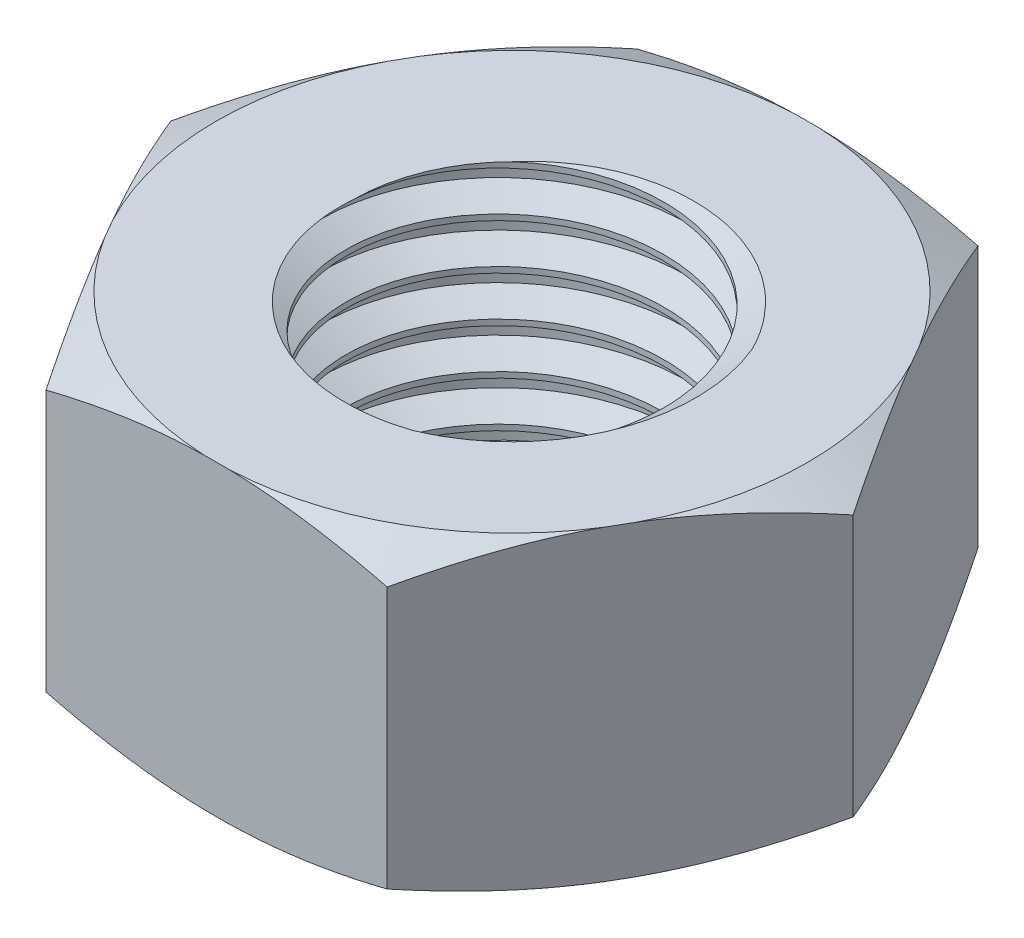
from build123d import *

# Parameters (mm, degrees)
CUT_EXTRUDE1_DEPTH      = 13.572290961
CUT_EXTRUDE1_DEPTH_BACK = 13.572290961
SKETCH2_OUTSIDE_W       = 21.452
SKETCH2_OUTSIDE_H       = 21.452
THREAD1_PITCH           = 1


with BuildPart() as part:
    # Sketch1 → Revolve1 (revolve)
    with BuildSketch(Plane(origin=(0, 0, 0), x_dir=(0, 0, -1), z_dir=(1, 0, 0)), mode=Mode.PRIVATE) as revolve1_sk:
        Polygon((-3.5, 0), (-3.5, 6.75), (-6.5, 6.75), (-7.5, 6.25), (-7.5, 0.5), (-6.5, 0), align=None)
    revolve(revolve1_sk.sketch.rotate(Axis((0, 0, 0), (0, 1, 0)), 180), axis=Axis((0, 0, 0), (0, 1, 0)))

    # Sketch2 outside → Cut-Extrude1 (cut, two sides: drawn at the far end of the back side and taken through both)
    with BuildSketch(Plane(origin=(0, 6.75, 0), x_dir=(1, 0, 0), z_dir=(0, 1, 0)).offset(-CUT_EXTRUDE1_DEPTH_BACK)):
        Rectangle(SKETCH2_OUTSIDE_W, SKETCH2_OUTSIDE_H)
        Polygon((-3.75, 6.495190528), (-7.5, 0), (-3.75, -6.495190528), (3.75, -6.495190528), (7.5, 0), (3.75, 6.495190528), align=None, mode=Mode.SUBTRACT)
    extrude(amount=CUT_EXTRUDE1_DEPTH + CUT_EXTRUDE1_DEPTH_BACK, mode=Mode.SUBTRACT)

    # Thread1: the profile of Thread Profile1 profile screwed along a right-hand helix of 7.75 turns, 8 arcs to a turn; built about Z, then put on its axis
    thread1_z = Axis((0, 0, 0), (0, 0, 1))
    thread1_corners = [(3.4997, 0, -0.000173205), (3.4997, 0, 0.875173202), (4.041265875, 0, 0.562499999), (4.041265875, 0, 0.312499999)]
    with BuildLine(mode=Mode.PRIVATE) as thread1_profile:
        Line(thread1_corners[0], thread1_corners[1])
        Line(thread1_corners[1], thread1_corners[2])
        Line(thread1_corners[2], thread1_corners[3])
        Line(thread1_corners[3], thread1_corners[0])
    thread1_cap = Face(thread1_profile.wire())
    thread1_turn_angles = [0, 22.5, 45, 67.5, 90, 112.5, 135, 157.5, 180, 202.5, 225, 247.5, 270, 292.5, 315, 337.5, 360]
    thread1_turn_weights = [1, 0.9238795325112867, 1, 0.9238795325112867, 1, 0.9238795325112867, 1, 0.9238795325112867, 1, 0.9238795325112867, 1, 0.9238795325112867, 1, 0.9238795325112867, 1, 0.9238795325112867, 1]
    thread1_turn_rails = [Edge.make_bspline([Vector(p[0], p[1], 0).rotate(thread1_z, thread1_turn_angles[k]) / thread1_turn_weights[k] + Vector(0, 0, p[2] + THREAD1_PITCH * thread1_turn_angles[k] / 360) for k in range(17)], [0, 0, 0, 1, 1, 2, 2, 3, 3, 4, 4, 5, 5, 6, 6, 7, 7, 8, 8, 8], 2, thread1_turn_weights) for p in thread1_corners]
    thread1_turn_sides = [Face.make_surface_from_curves(thread1_turn_rails[p[0]], thread1_turn_rails[p[1]]) for p in [(0, 1), (1, 2), (2, 3), (3, 0)]]
    thread1_last_angles = [2520, 2542.5, 2565, 2587.5, 2610, 2632.5, 2655, 2677.5, 2700, 2722.5, 2745, 2767.5, 2790]
    thread1_last_weights = [1, 0.9238795325112867, 1, 0.9238795325112867, 1, 0.9238795325112867, 1, 0.9238795325112867, 1, 0.9238795325112867, 1, 0.9238795325112883, 1]
    thread1_last_rails = [Edge.make_bspline([Vector(p[0], p[1], 0).rotate(thread1_z, thread1_last_angles[k]) / thread1_last_weights[k] + Vector(0, 0, p[2] + THREAD1_PITCH * thread1_last_angles[k] / 360) for k in range(13)], [0, 0, 0, 1, 1, 2, 2, 3, 3, 4, 4, 5, 5, 6, 6, 6], 2, thread1_last_weights) for p in thread1_corners]
    thread1_last_sides = [Face.make_surface_from_curves(thread1_last_rails[p[0]], thread1_last_rails[p[1]]) for p in [(0, 1), (1, 2), (2, 3), (3, 0)]]
    thread1 = Plane(origin=(0, 7.75, 0), x_dir=(-1, 0, 0), z_dir=(0, -1, 0)) * Solid(Shell([*[p.moved(Location((0, 0, THREAD1_PITCH * i))) for i in range(7) for p in thread1_turn_sides], *thread1_last_sides, thread1_cap, thread1_cap.rotate(thread1_z, 2790).moved(Location((0, 0, THREAD1_PITCH * 2790 / 360)))]))
    add(thread1, mode=Mode.SUBTRACT)


solid = part.part
